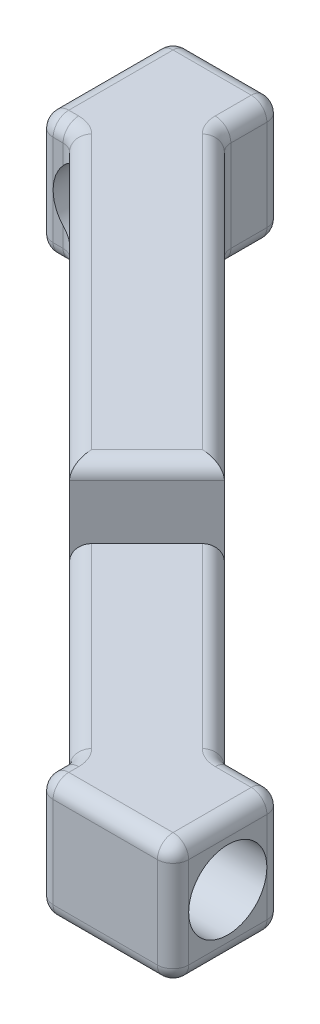
from build123d import *

# Parameters (mm, degrees)
BOSS_EXTRUDE1_DEPTH     = 37
CUT_EXTRUDE1_DEPTH      = 101.656930314
CUT_EXTRUDE1_DEPTH_BACK = 101.656930314
SKETCH6_R               = 7.5
CUT_EXTRUDE2_DEPTH      = 143.407678732
SKETCH7_R               = 7.5
CUT_EXTRUDE3_DEPTH      = 143.407678732
FILLET1_R               = 3


with BuildPart() as part:
    # Sketch3 → Boss-Extrude1 (new body)
    with BuildSketch(Plane(origin=(0, 0, 0), x_dir=(1, 0, 0), z_dir=(0, 1, 0))):
        Polygon((-59.997474683, 62.497474683), (-38.997474683, 62.497474683), (-38.997474683, 51.346717088), (51.346717088, -38.997474683), (62.497474683, -38.997474683), (62.497474683, -59.997474683), (36.497474683, -59.997474683), (36.497474683, -53.846717088), (-53.846717088, 36.497474683), (-59.997474683, 36.497474683), align=None)
    extrude(amount=BOSS_EXTRUDE1_DEPTH)

    # Sketch5 → Cut-Extrude1 (cut, two sides: drawn at the far end of the back side and taken through both)
    with BuildSketch(Plane(origin=(7.806349186, 0, -4.542893219), x_dir=(0.7071067811865459, 0, 0.7071067811865491), z_dir=(-0.7071067811865491, 0, 0.7071067811865459)).offset(-CUT_EXTRUDE1_DEPTH_BACK)):
        Polygon((61.575378798, 37), (12.192388155, 37), (12.192388155, 23.5), (84.309397513, 23.5), (84.309397513, 37), (69.460155108, 37), align=None)
        Polygon((-9.807611845, 0), (-66.190602487, 0), (-74.075378798, 0), (-88.924621202, 0), (-88.924621202, 13.5), (-9.807611845, 13.5), align=None)
    extrude(amount=CUT_EXTRUDE1_DEPTH + CUT_EXTRUDE1_DEPTH_BACK, mode=Mode.SUBTRACT)

    # Sketch6 → Cut-Extrude2 (cut, through all)
    with BuildSketch(Plane(origin=(62.497474683, 0, 0), x_dir=(0, 0, -1), z_dir=(1, 0, 0))):
        with Locations((-49.497474683, 11.75)):
            Circle(SKETCH6_R)
    extrude(amount=-CUT_EXTRUDE2_DEPTH, mode=Mode.SUBTRACT)

    # Sketch7 → Cut-Extrude3 (cut, through all)
    with BuildSketch(Plane(origin=(0, 0, -62.497474683), x_dir=(-1, 0, 0), z_dir=(0, 0, -1))):
        with Locations((49.497474683, 25.25)):
            Circle(SKETCH7_R)
    extrude(amount=-CUT_EXTRUDE3_DEPTH, mode=Mode.SUBTRACT)

    # Fillet1
    fillet1_edges = [part.edges().sort_by_distance(p)[0] for p in [
        (56.922095886, 0, 38.997474683),
        (56.922095886, 23.5, 38.997474683),
        (-38.997474683, 25.25, -51.346717088),
        (26.109018716, 0, 13.759776311),
        (51.346717088, 11.75, 38.997474683),
        (33.887193309, 23.5, 21.537950904),
        (62.497474683, 0, 49.497474683),
        (62.497474683, 11.75, 59.997474683),
        (62.497474683, 23.5, 49.497474683),
        (62.497474683, 11.75, 38.997474683),
        (-6.553300859, 0, -4.053300859),
        (-33.912319575, 13.5, -16.56307717),
        (-19.06307717, 13.5, -31.412319575),
        (-38.997474683, 13.5, -56.922095886),
        (-56.922095886, 13.5, -36.497474683),
        (-59.997474683, 25.25, -36.497474683),
        (-59.997474683, 13.5, -49.497474683),
        (-59.997474683, 25.25, -62.497474683),
        (-49.497474683, 13.5, -62.497474683),
        (-38.997474683, 25.25, -62.497474683),
        (-26.134144982, 37, -8.784902577),
        (-56.922095886, 37, -36.497474683),
        (-59.997474683, 37, -49.497474683),
        (-49.497474683, 37, -62.497474683),
        (-38.997474683, 37, -56.922095886),
        (-11.284902577, 37, -23.634144982),
        (9.003048327, 37, 11.503048327),
        (19.037950904, 23.5, 36.387193309),
        (11.259776311, 0, 28.609018716),
        (49.497474683, 0, 59.997474683),
        (49.497474683, 23.5, 59.997474683),
        (36.497474683, 11.75, 59.997474683),
        (36.497474683, 0, 56.922095886),
        (-53.846717088, 16.319918557, -36.497474683),
        (-53.846717088, 34.180081443, -36.497474683),
        (36.497474683, 20.680081443, 53.846717088),
        (36.497474683, 2.819918557, 53.846717088),
        (36.497474683, 23.5, 56.922095886),
    ]]
    fillet(fillet1_edges, radius=FILLET1_R - 0.0001)  # a hair under: the kernel refuses the full size


solid = part.part
